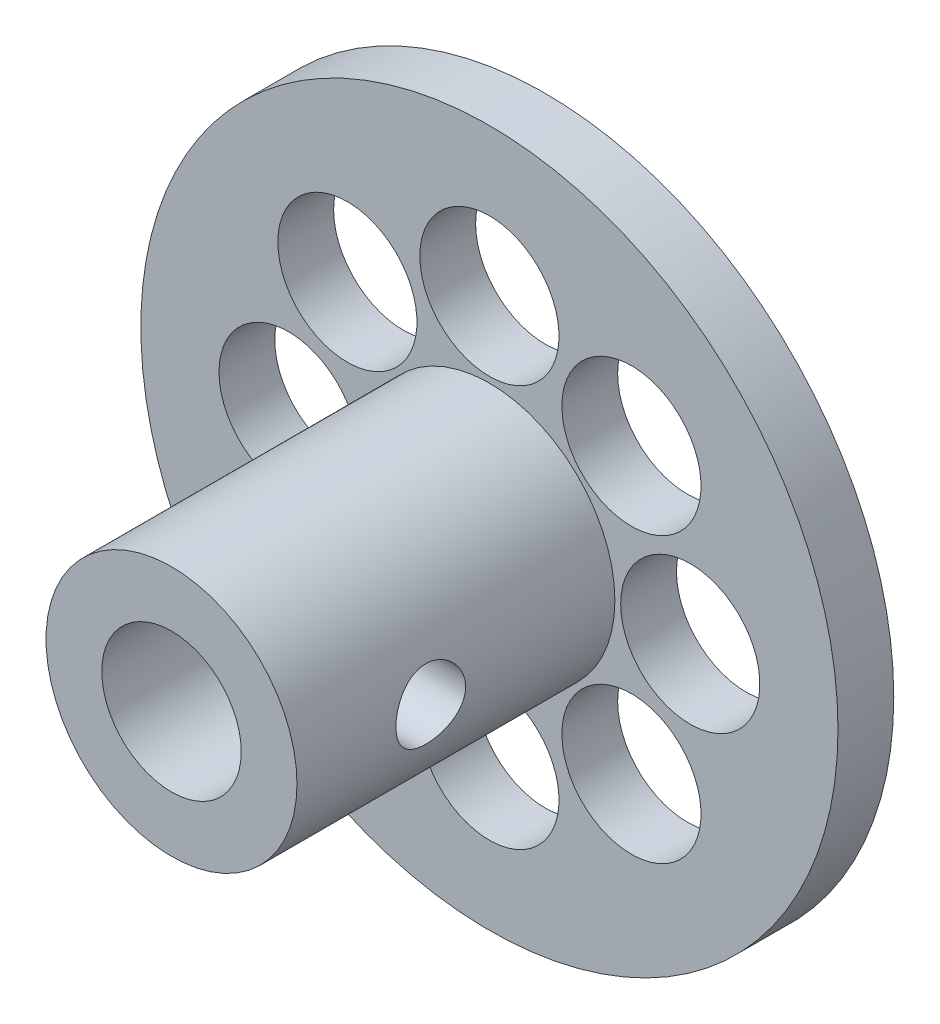
from build123d import *
from build123d.topology import SkipClean

# Parameters (mm, degrees)
SKETCH1_R               = 31.75
BOSS_EXTRUDE1_DEPTH     = 5.08
SKETCH2_R               = 6.35
CUT_EXTRUDE1_DEPTH      = 5.08
SKETCH3_R               = 11.43
BOSS_EXTRUDE2_DEPTH     = 28.956
CUT_EXTRUDE2_START      = -29.21
SKETCH5_R               = 6.35
CUT_EXTRUDE2_DEPTH      = 29.21
SKETCH6_R               = 6.337124867
CUT_EXTRUDE3_DEPTH      = 5.08
CUT_EXTRUDE4_DEPTH      = 17.526
CUT_EXTRUDE4_DEPTH_BACK = 11.938
SKETCH7_R               = 3.175


with BuildPart() as part:
    # Sketch1 → Boss-Extrude1 (new body)
    with BuildSketch(Plane.XY):
        Circle(SKETCH1_R)
    extrude(amount=BOSS_EXTRUDE1_DEPTH)

    # Sketch2 → Cut-Extrude1 (cut)
    with BuildSketch(Plane(origin=(0, 0, 0), x_dir=(-1, 0, 0), z_dir=(0, 0, -1))):
        Circle(SKETCH2_R)
    extrude(amount=-CUT_EXTRUDE1_DEPTH, mode=Mode.SUBTRACT)

    # Sketch3 → Boss-Extrude2 (add)
    with BuildSketch(Plane.XY.offset(5.08)):
        Circle(SKETCH3_R)
    extrude(amount=BOSS_EXTRUDE2_DEPTH)

    # Sketch5 → Cut-Extrude2 (cut)
    with SkipClean():  # the faces are left unmerged after this step: merging them gives an invalid solid
        with BuildSketch(Plane.XY.offset(34.036).offset(CUT_EXTRUDE2_START)):
            Circle(SKETCH5_R)
        extrude(amount=CUT_EXTRUDE2_DEPTH, mode=Mode.SUBTRACT)
    add(part.part.scale(1), mode=Mode.REPLACE)  # the faces are merged on a copy

    # Sketch6 → Cut-Extrude3 (cut)
    with BuildSketch(Plane(origin=(0, 0, 0), x_dir=(-1, 0, 0), z_dir=(0, 0, -1))):
        with Locations((0, 18.294370769)):
            Circle(SKETCH6_R)
        with Locations((12.936073628, 12.936073628)):
            Circle(SKETCH6_R)
        with Locations((18.294370769, 0)):
            Circle(SKETCH6_R)
        with Locations((12.936073628, -12.936073628)):
            Circle(SKETCH6_R)
        with Locations((0, -18.294370769)):
            Circle(SKETCH6_R)
        with Locations((-12.936073628, -12.936073628)):
            Circle(SKETCH6_R)
        with Locations((-18.294370769, 0)):
            Circle(SKETCH6_R)
        with Locations((-12.936073628, 12.936073628)):
            Circle(SKETCH6_R)
    extrude(amount=-CUT_EXTRUDE3_DEPTH, mode=Mode.SUBTRACT)

    # Sketch7 → Cut-Extrude4 (cut, two sides: drawn at the far end of the back side and taken through both)
    with BuildSketch(Plane(origin=(0, 0, 0), x_dir=(0, 0, -1), z_dir=(1, 0, 0)).offset(-CUT_EXTRUDE4_DEPTH_BACK)):
        with Locations((-21.851313678, 0)):
            Circle(SKETCH7_R)
    extrude(amount=CUT_EXTRUDE4_DEPTH + CUT_EXTRUDE4_DEPTH_BACK, mode=Mode.SUBTRACT)


solid = part.part
